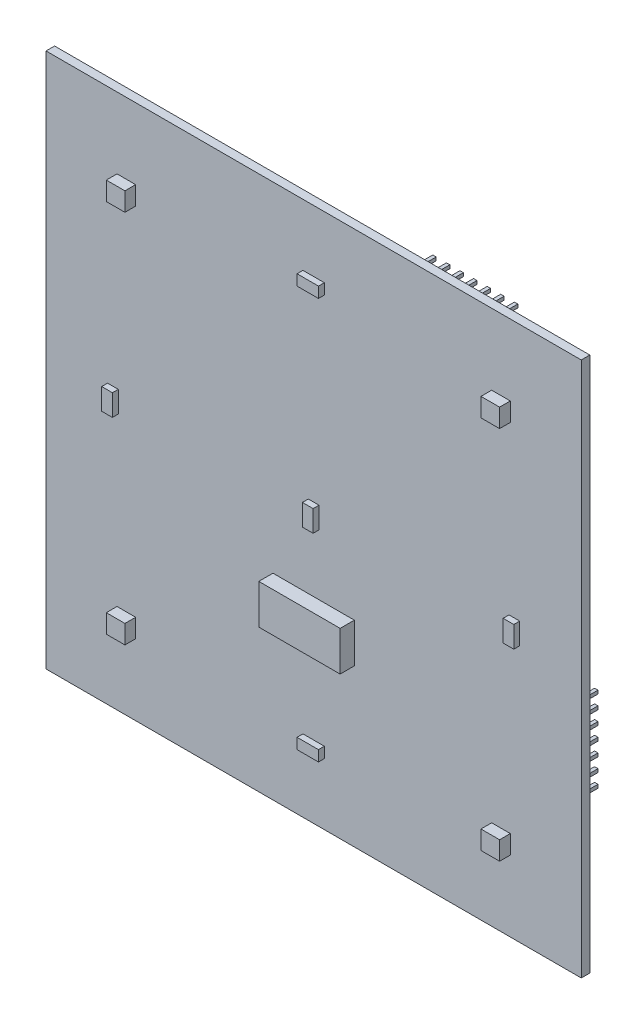
from build123d import *

# Parameters (mm, degrees)
SKETCH_1_W       = 100
SKETCH_1_H       = 100
EXTRUDE_1_DEPTH  = 1.6
SKETCH_4_W       = 17.78
SKETCH_4_H       = 2.5
SKETCH_4_W_2     = 2.5
SKETCH_4_H_2     = 17.78
EXTRUDE_2_DEPTH  = 2.5
SKETCH_5_W       = 0.64
SKETCH_5_H       = 0.64
EXTRUDE_3_DEPTH  = 6.1
SKETCH_6_W       = 3.48
SKETCH_6_H       = 3.48
EXTRUDE_4_DEPTH  = 2
SKETCH_7_W       = 2
SKETCH_7_H       = 4
SKETCH_7_W_2     = 4
SKETCH_7_H_2     = 2
EXTRUDE_5_DEPTH  = 1.1
SKETCH_8_W       = 15.2
SKETCH_8_H       = 7.4
EXTRUDE_6_DEPTH  = 2.65
SKETCH_9_W       = 7.62
SKETCH_9_H       = 2.5
EXTRUDE_7_DEPTH  = 2.5
SKETCH_11_W      = 0.64
SKETCH_11_H      = 0.64
EXTRUDE_8_DEPTH  = 6.1
EXTRUDE_9_DEPTH  = 6
SKETCH_14_R      = 1
SKETCH_14_W      = 7.62
SKETCH_14_H      = 2.5
EXTRUDE_10_DEPTH = 2


with BuildPart() as part:
    # ｽｹｯﾁ1 → ﾎﾞｽ - 押し出し1 (new body)
    with BuildSketch(Plane.XY):
        Rectangle(SKETCH_1_W, SKETCH_1_H)
    extrude(amount=EXTRUDE_1_DEPTH)

    # ｽｹｯﾁ4 → ﾎﾞｽ - 押し出し2 (add)
    with BuildSketch(Plane(origin=(0, 0, 0), x_dir=(-1, 0, 0), z_dir=(0, 0, -1))):
        with Locations((20, -42.6)):
            Rectangle(SKETCH_4_W, SKETCH_4_H)
        with Locations((-42.6, -20)):
            Rectangle(SKETCH_4_W_2, SKETCH_4_H_2)
        with Locations((-20, 42.6)):
            Rectangle(SKETCH_4_W, SKETCH_4_H)
        with Locations((42.6, 20)):
            Rectangle(SKETCH_4_W_2, SKETCH_4_H_2)
    extrude(amount=EXTRUDE_2_DEPTH)

    # ｽｹｯﾁ5 → ﾎﾞｽ - 押し出し3 (add)
    with BuildSketch(Plane(origin=(0, 0, -2.5), x_dir=(-1, 0, 0), z_dir=(0, 0, -1))):
        with Locations((-20, 42.6)):
            Rectangle(SKETCH_5_W, SKETCH_5_H)
        with Locations((-17.46, 42.6)):
            Rectangle(SKETCH_5_W, SKETCH_5_H)
        with Locations((-14.92, 42.6)):
            Rectangle(SKETCH_5_W, SKETCH_5_H)
        with Locations((-12.38, 42.6)):
            Rectangle(SKETCH_5_W, SKETCH_5_H)
        with Locations((-22.54, 42.6)):
            Rectangle(SKETCH_5_W, SKETCH_5_H)
        with Locations((-25.08, 42.6)):
            Rectangle(SKETCH_5_W, SKETCH_5_H)
        with Locations((-27.62, 42.6)):
            Rectangle(SKETCH_5_W, SKETCH_5_H)
        with Locations((-42.6, -20)):
            Rectangle(SKETCH_5_W, SKETCH_5_H)
        with Locations((-42.6, -22.54)):
            Rectangle(SKETCH_5_W, SKETCH_5_H)
        with Locations((42.6, 20)):
            Rectangle(SKETCH_5_W, SKETCH_5_H)
        with Locations((-42.6, -25.08)):
            Rectangle(SKETCH_5_W, SKETCH_5_H)
        with Locations((-42.6, -27.62)):
            Rectangle(SKETCH_5_W, SKETCH_5_H)
        with Locations((-42.6, -17.46)):
            Rectangle(SKETCH_5_W, SKETCH_5_H)
        with Locations((-42.6, -14.92)):
            Rectangle(SKETCH_5_W, SKETCH_5_H)
        with Locations((-42.6, -12.38)):
            Rectangle(SKETCH_5_W, SKETCH_5_H)
        with Locations((42.6, 17.46)):
            Rectangle(SKETCH_5_W, SKETCH_5_H)
        with Locations((42.6, 14.92)):
            Rectangle(SKETCH_5_W, SKETCH_5_H)
        with Locations((42.6, 12.38)):
            Rectangle(SKETCH_5_W, SKETCH_5_H)
        with Locations((42.6, 22.54)):
            Rectangle(SKETCH_5_W, SKETCH_5_H)
        with Locations((42.6, 25.08)):
            Rectangle(SKETCH_5_W, SKETCH_5_H)
        with Locations((42.6, 27.62)):
            Rectangle(SKETCH_5_W, SKETCH_5_H)
        with Locations((20, -42.6)):
            Rectangle(SKETCH_5_W, SKETCH_5_H)
        with Locations((17.46, -42.6)):
            Rectangle(SKETCH_5_W, SKETCH_5_H)
        with Locations((14.92, -42.6)):
            Rectangle(SKETCH_5_W, SKETCH_5_H)
        with Locations((12.38, -42.6)):
            Rectangle(SKETCH_5_W, SKETCH_5_H)
        with Locations((22.54, -42.6)):
            Rectangle(SKETCH_5_W, SKETCH_5_H)
        with Locations((25.08, -42.6)):
            Rectangle(SKETCH_5_W, SKETCH_5_H)
        with Locations((27.62, -42.6)):
            Rectangle(SKETCH_5_W, SKETCH_5_H)
    extrude(amount=EXTRUDE_3_DEPTH)

    # ｽｹｯﾁ6 → ﾎﾞｽ - 押し出し4 (add)
    with BuildSketch(Plane.XY.offset(1.6)):
        with Locations((-35, -35)):
            Rectangle(SKETCH_6_W, SKETCH_6_H)
        with Locations((-35, 35)):
            Rectangle(SKETCH_6_W, SKETCH_6_H)
        with Locations((35, -35)):
            Rectangle(SKETCH_6_W, SKETCH_6_H)
        with Locations((35, 35)):
            Rectangle(SKETCH_6_W, SKETCH_6_H)
    extrude(amount=EXTRUDE_4_DEPTH)

    # ｽｹｯﾁ7 → ﾎﾞｽ - 押し出し5 (add)
    with BuildSketch(Plane.XY.offset(1.6)):
        with Locations((-37.5, 0)):
            Rectangle(SKETCH_7_W, SKETCH_7_H)
        with Locations((37.5, 0)):
            Rectangle(SKETCH_7_W, SKETCH_7_H)
        with Locations((0, 37.5)):
            Rectangle(SKETCH_7_W_2, SKETCH_7_H_2)
        with Locations((0, -37.5)):
            Rectangle(SKETCH_7_W_2, SKETCH_7_H_2)
        Rectangle(SKETCH_7_W, SKETCH_7_H)
    extrude(amount=EXTRUDE_5_DEPTH)

    # ｽｹｯﾁ8 → ﾎﾞｽ - 押し出し6 (add)
    with BuildSketch(Plane.XY.offset(1.6)):
        with Locations((0, -17)):
            Rectangle(SKETCH_8_W, SKETCH_8_H)
    extrude(amount=EXTRUDE_6_DEPTH)

    # ｽｹｯﾁ9 → ﾎﾞｽ - 押し出し7 (add)
    with BuildSketch(Plane(origin=(0, 0, 0), x_dir=(-1, 0, 0), z_dir=(0, 0, -1))):
        with Locations((-0.8, 18.58)):
            Rectangle(SKETCH_9_W, SKETCH_9_H)
    extrude(amount=EXTRUDE_7_DEPTH)

    # ｽｹｯﾁ11 → ﾎﾞｽ - 押し出し8 (add)
    with BuildSketch(Plane(origin=(0, 0, -2.5), x_dir=(-1, 0, 0), z_dir=(0, 0, -1))):
        with Locations((-0.8, 18.58)):
            Rectangle(SKETCH_11_W, SKETCH_11_H)
        with Locations((-3.34, 18.58)):
            Rectangle(SKETCH_11_W, SKETCH_11_H)
        with Locations((1.74, 18.58)):
            Rectangle(SKETCH_11_W, SKETCH_11_H)
    extrude(amount=EXTRUDE_8_DEPTH)

    # ｽｹｯﾁ13 → ﾎﾞｽ - 押し出し9 (add)
    with BuildSketch(Plane(origin=(0, 0, 0), x_dir=(-1, 0, 0), z_dir=(0, 0, -1))):
        Polygon((32, -30), (31, -28.267949192), (29, -28.267949192), (28, -30), (29, -31.732050808), (31, -31.732050808), align=None)
        Polygon((-28, -30), (-29, -28.267949192), (-31, -28.267949192), (-32, -30), (-31, -31.732050808), (-29, -31.732050808), align=None)
        Polygon((32, 30), (31, 31.732050808), (29, 31.732050808), (28, 30), (29, 28.267949192), (31, 28.267949192), align=None)
        Polygon((-28, 30), (-29, 31.732050808), (-31, 31.732050808), (-32, 30), (-31, 28.267949192), (-29, 28.267949192), align=None)
    extrude(amount=EXTRUDE_9_DEPTH)

    # ｽｹｯﾁ14 → ﾎﾞｽ - 押し出し10 (add)
    with BuildSketch(Plane(origin=(0, 0, -6), x_dir=(-1, 0, 0), z_dir=(0, 0, -1))):
        Polygon((0, -39), (0, -41), (39, -41), (39, 0), (41, 0), (41, 39), (0, 39), (0, 41), (-39, 41), (-39, 0), (-41, 0), (-41, -39), align=None)
        with Locations((-30, 30)):
            Circle(SKETCH_14_R, mode=Mode.SUBTRACT)
        with Locations((30, 30)):
            Circle(SKETCH_14_R, mode=Mode.SUBTRACT)
        with Locations((30, -30)):
            Circle(SKETCH_14_R, mode=Mode.SUBTRACT)
        with Locations((-30, -30)):
            Circle(SKETCH_14_R, mode=Mode.SUBTRACT)
        with Locations((-0.8, 18.58)):
            Rectangle(SKETCH_14_W, SKETCH_14_H, mode=Mode.SUBTRACT)
    extrude(amount=EXTRUDE_10_DEPTH)


solid = part.part
